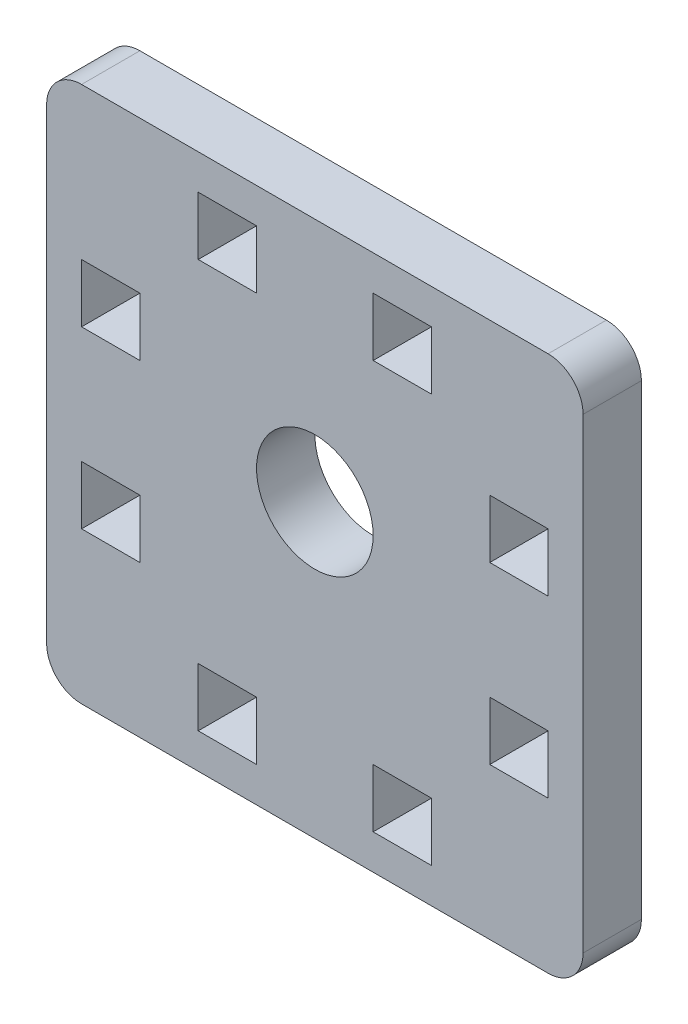
from build123d import *

# Parameters (mm, degrees)
BOSS_EXTRU_1_OUTLINE_W   = 46
BOSS_EXTRU_1_OUTLINE_H   = 46
BOSS_EXTRU_1_OUTLINE_W_2 = 5
BOSS_EXTRU_1_OUTLINE_H_2 = 5
BOSS_EXTRU_1_OUTLINE_R   = 5
BOSS_EXTRU_1_DEPTH       = 5
CONG_1_R                 = 3


# Read off the part's stored shape, not the designer's step: Boss.-Extru.1
with BuildPart() as part:
    # Boss.-Extru.1 outline → Boss.-Extru.1 (new body)
    with BuildSketch(Plane.XY):
        with Locations((0, 23)):
            Rectangle(BOSS_EXTRU_1_OUTLINE_W, BOSS_EXTRU_1_OUTLINE_H)
        with Locations((-7.5, 5.5)):
            Rectangle(BOSS_EXTRU_1_OUTLINE_W_2, BOSS_EXTRU_1_OUTLINE_H_2, mode=Mode.SUBTRACT)
        with Locations((-17.5, 15.5)):
            Rectangle(BOSS_EXTRU_1_OUTLINE_W_2, BOSS_EXTRU_1_OUTLINE_H_2, mode=Mode.SUBTRACT)
        with Locations((7.5, 5.5)):
            Rectangle(BOSS_EXTRU_1_OUTLINE_W_2, BOSS_EXTRU_1_OUTLINE_H_2, mode=Mode.SUBTRACT)
        with Locations((17.5, 15.5)):
            Rectangle(BOSS_EXTRU_1_OUTLINE_W_2, BOSS_EXTRU_1_OUTLINE_H_2, mode=Mode.SUBTRACT)
        with Locations((-17.5, 30.5)):
            Rectangle(BOSS_EXTRU_1_OUTLINE_W_2, BOSS_EXTRU_1_OUTLINE_H_2, mode=Mode.SUBTRACT)
        with Locations((-7.5, 40.5)):
            Rectangle(BOSS_EXTRU_1_OUTLINE_W_2, BOSS_EXTRU_1_OUTLINE_H_2, mode=Mode.SUBTRACT)
        with Locations((0, 25)):
            Circle(BOSS_EXTRU_1_OUTLINE_R, mode=Mode.SUBTRACT)
        with Locations((17.5, 30.5)):
            Rectangle(BOSS_EXTRU_1_OUTLINE_W_2, BOSS_EXTRU_1_OUTLINE_H_2, mode=Mode.SUBTRACT)
        with Locations((7.5, 40.5)):
            Rectangle(BOSS_EXTRU_1_OUTLINE_W_2, BOSS_EXTRU_1_OUTLINE_H_2, mode=Mode.SUBTRACT)
    extrude(amount=BOSS_EXTRU_1_DEPTH)

    # Congé1
    cong_1_edges = [part.edges().sort_by_distance(p)[0] for p in [
        (-23, 0, 2.5),
        (-23, 46, 2.5),
        (23, 46, 2.5),
        (23, 0, 2.5),
    ]]
    fillet(cong_1_edges, radius=CONG_1_R)


solid = part.part
